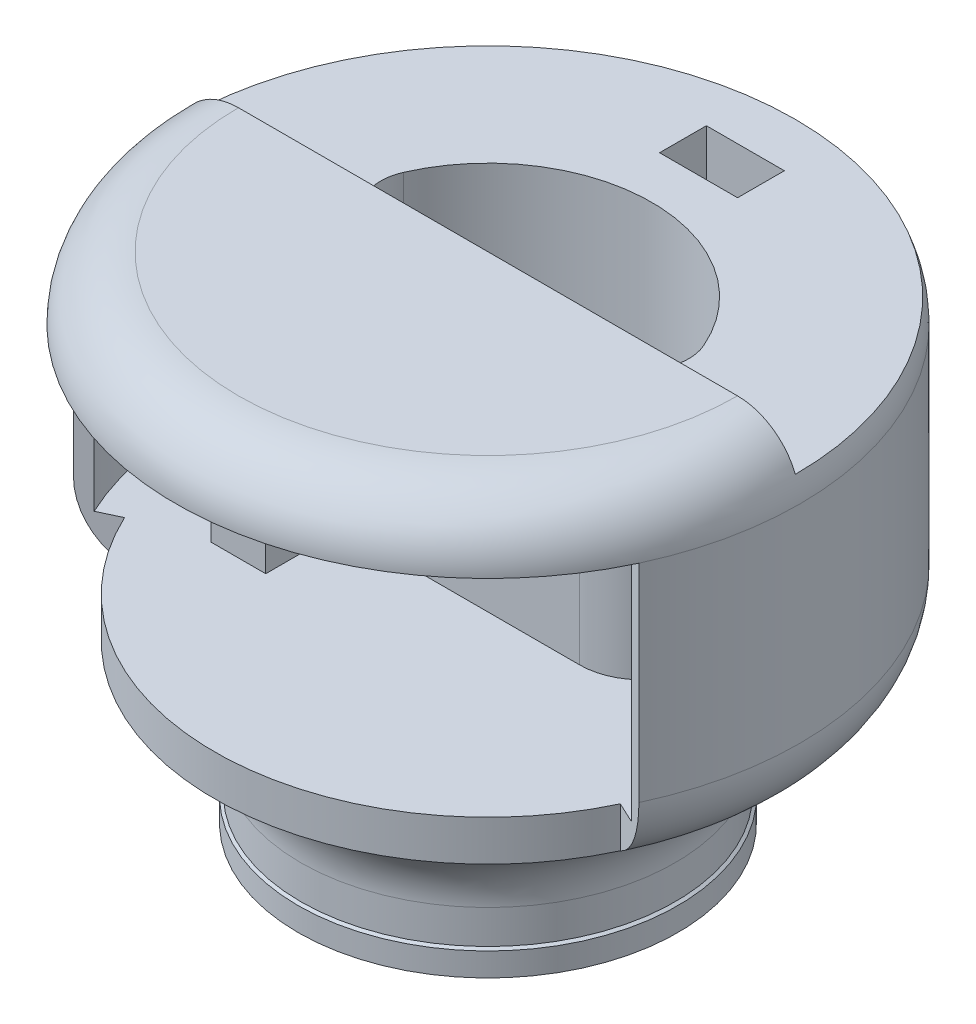
from build123d import *

# Parameters (mm, degrees)
CUT_EXTRUDE3_DEPTH           = 60
CUT_EXTRUDE5_DEPTH           = 2
CUT_EXTRUDE5_DEPTH_BACK      = 30
SKETCH9_R                    = 38
SKETCH9_R_2                  = 23
SKETCH19_W                   = 12
SKETCH19_H                   = 36.5
CUT_REVOLVE2_ANGLE           = 65
CUT_REVOLVE2_OTHER_WAY_ANGLE = 65
SKETCH21_W                   = 3.25
SKETCH21_H                   = 4
BOSS_EXTRUDE3_DEPTH          = 1.35
CIRPATTERN1_COUNT            = 5
CUT_EXTRUDE9_START           = -5
CUT_EXTRUDE9_DEPTH           = 5
SKETCH23_R                   = 10.5
CUT_EXTRUDE10_DEPTH          = 10
SKETCH24_W                   = 15
SKETCH24_H                   = 8
BOSS_EXTRUDE4_DEPTH          = 8
SKETCH26_W                   = 10
SKETCH26_H                   = 6
CUT_EXTRUDE11_DEPTH          = 10
SKETCH27_W                   = 4
SKETCH27_H                   = 5
CUT_EXTRUDE12_DEPTH          = 5
CUT_EXTRUDE14_DEPTH          = 2
CUT_EXTRUDE14_DEPTH_BACK     = 30
SKETCH29_R                   = 1
CUT_EXTRUDE15_DEPTH          = 15
FILLET1_R                    = 6
FILLET2_R                    = 8
SKETCH31_W                   = 7
SKETCH31_H                   = 5
BOSS_EXTRUDE7_DEPTH          = 13
SKETCH32_R                   = 1.25
CUT_EXTRUDE16_DEPTH          = 7.5


with BuildPart() as part:
    # Sketch1 → Revolve1 (revolve)
    with BuildSketch(Plane.XY):
        with BuildLine():
            Line((0, 63.427876097), (32, 63.427876097))
            ThreePointArc((32, 63.427876097), (37.656854249, 61.084730346), (40, 55.427876097))
            Line((40, 55.427876097), (40, 28.846818009))
            ThreePointArc((40, 28.846818009), (38.792081772, 24.082439968), (35.460140376, 20.469057744))
            Line((35.460140376, 20.469057744), (28.539859624, 15.958818353))
            ThreePointArc((28.539859624, 15.958818353), (25.207918228, 12.345436129), (24, 7.581058088))
            Line((24, 7.581058088), (24, 3.25))
            Line((24, 3.25), (24.35, 3))
            Line((24.35, 3), (24.35, 0))
            Line((24.35, 0), (22.5, 0))
            Line((22.5, 0), (22.5, 12.5))
            ThreePointArc((22.5, 12.5), (22.353553391, 12.853553391), (22, 13))
            Line((22, 13), (0, 13))
            Line((0, 13), (0, 63.427876097))
        make_face()
    revolve(axis=Axis((0, 0, 0), (0, 1, 0)))

    # Sketch11 → Cut-Extrude3 (cut)
    with BuildSketch(Plane(origin=(0, 13, 0), x_dir=(-1, 0, 0), z_dir=(0, -1, 0))):
        with BuildLine():
            Line((-21, 0), (21, 0))
            ThreePointArc((21, 0), (0, 21), (-21, 0))
        make_face()
    extrude(amount=-CUT_EXTRUDE3_DEPTH, mode=Mode.SUBTRACT)

    # Sketch9 → Cut-Extrude5 (cut, two sides: drawn at the far end of the back side and taken through both)
    with BuildSketch(Plane(origin=(0, 55.427876097, 0), x_dir=(1, 0, 0), z_dir=(0, 1, 0)).offset(-CUT_EXTRUDE5_DEPTH_BACK)):
        Circle(SKETCH9_R)
        Circle(SKETCH9_R_2, mode=Mode.SUBTRACT)
    extrude(amount=CUT_EXTRUDE5_DEPTH + CUT_EXTRUDE5_DEPTH_BACK, mode=Mode.SUBTRACT)

    # Sketch19 → Cut-Revolve2 (revolve, cut)
    with BuildSketch(Plane(origin=(0, 0, 0), x_dir=(0, 0, -1), z_dir=(1, 0, 0))):
        with Locations((-41.064715832, 37.177876097)):
            Rectangle(SKETCH19_W, SKETCH19_H)
    revolve(axis=Axis((0, 0, 0), (0, 1, 0)), revolution_arc=CUT_REVOLVE2_ANGLE, mode=Mode.SUBTRACT)

    # Sketch19 → Cut-Revolve2 other way (revolve, cut)
    with BuildSketch(Plane(origin=(0, 0, 0), x_dir=(0, 0, -1), z_dir=(1, 0, 0))):
        with Locations((-41.064715832, 37.177876097)):
            Rectangle(SKETCH19_W, SKETCH19_H)
    revolve(axis=Axis((0, 0, 0), (0, -1, 0)), revolution_arc=CUT_REVOLVE2_OTHER_WAY_ANGLE, mode=Mode.SUBTRACT)

    # Sketch21 → Boss-Extrude3 (add)
    with BuildSketch(Plane(origin=(0, 0, 22.5), x_dir=(-1, 0, 0), z_dir=(0, 0, -1))):
        with Locations((0, 2)):
            Rectangle(SKETCH21_W, SKETCH21_H)
    boss_extrude3 = extrude(amount=BOSS_EXTRUDE3_DEPTH)

    # CirPattern1: Boss-Extrude3 ×5 about axis
    cirpattern1_axis = Axis((0, 0, 0), (0, -1, 0))
    for i in range(1, CIRPATTERN1_COUNT):
        add(boss_extrude3.rotate(cirpattern1_axis, i * 360 / CIRPATTERN1_COUNT))

    # Sketch22 → Cut-Extrude9 (cut)
    with BuildSketch(Plane(origin=(0, 63.427876097, 0), x_dir=(1, 0, 0), z_dir=(0, 1, 0)).offset(CUT_EXTRUDE9_START)):
        with BuildLine():
            Line((-40, 0), (40, 0))
            ThreePointArc((40, 0), (0, 40), (-40, 0))
        make_face()
    extrude(amount=CUT_EXTRUDE9_DEPTH, mode=Mode.SUBTRACT)

    # Sketch23 → Cut-Extrude10 (cut)
    with BuildSketch(Plane(origin=(0, 0, -40), x_dir=(-1, 0, 0), z_dir=(0, 0, -1))):
        with Locations((0, 42.137876097)):
            Circle(SKETCH23_R)
    extrude(amount=-CUT_EXTRUDE10_DEPTH, mode=Mode.SUBTRACT)

    # Sketch24 → Boss-Extrude4 (add)
    with BuildSketch(Plane(origin=(0, 58.427876097, 0), x_dir=(1, 0, 0), z_dir=(0, 1, 0))):
        with Locations((0, 30)):
            Rectangle(SKETCH24_W, SKETCH24_H)
    extrude(amount=-BOSS_EXTRUDE4_DEPTH)

    # Sketch26 → Cut-Extrude11 (cut)
    with BuildSketch(Plane(origin=(0, 58.427876097, 0), x_dir=(1, 0, 0), z_dir=(0, 1, 0))):
        with Locations((0, 30)):
            Rectangle(SKETCH26_W, SKETCH26_H)
    extrude(amount=-CUT_EXTRUDE11_DEPTH, mode=Mode.SUBTRACT)

    # Sketch27 → Cut-Extrude12 (cut)
    with BuildSketch(Plane(origin=(7.5, 0, 0), x_dir=(0, 0, -1), z_dir=(1, 0, 0))):
        with Locations((30, 53.927876097)):
            Rectangle(SKETCH27_W, SKETCH27_H)
    extrude(amount=-CUT_EXTRUDE12_DEPTH, mode=Mode.SUBTRACT)

    # Sketch28 → Cut-Extrude14 (cut, two sides: drawn at the far end of the back side and taken through both)
    with BuildSketch(Plane(origin=(0, 55.427876097, 0), x_dir=(1, 0, 0), z_dir=(0, 1, 0)).offset(-CUT_EXTRUDE14_DEPTH_BACK)):
        with BuildLine():
            Line((-22.912878475, -2), (22.912878475, -2))
            ThreePointArc((22.912878475, -2), (0, -23), (-22.912878475, -2))
        make_face()
    extrude(amount=CUT_EXTRUDE14_DEPTH + CUT_EXTRUDE14_DEPTH_BACK, mode=Mode.SUBTRACT)

    # Sketch29 → Cut-Extrude15 (cut)
    with BuildSketch(Plane(origin=(0, 0, 0), x_dir=(-1, 0, 0), z_dir=(0, 0, -1))):
        with Locations((-30.416198487, 60.927876097)):
            Circle(SKETCH29_R)
        with Locations((30.416198487, 60.927876097)):
            Circle(SKETCH29_R)
        with Locations((0, 60.927876097)):
            Circle(SKETCH29_R)
    extrude(amount=-CUT_EXTRUDE15_DEPTH, mode=Mode.SUBTRACT)

    # Fillet1
    fillet1_edges = [part.edges().sort_by_distance(p)[0] for p in [
        (-21, 35.713938048, 0),
        (21, 35.713938048, 0),
    ]]
    fillet(fillet1_edges, radius=FILLET1_R)

    # Fillet2
    fillet2_edges = [part.edges().sort_by_distance(p)[0] for p in [
        (22.912878475, 41.427876097, 2),
        (-22.912878475, 41.427876097, 2),
    ]]
    fillet(fillet2_edges, radius=FILLET2_R)

    # Sketch31 → Boss-Extrude7 (add)
    with BuildSketch(Plane(origin=(0, 58.427876097, 0), x_dir=(1, 0, 0), z_dir=(0, 1, 0))):
        with Locations((0, -29.5)):
            Rectangle(SKETCH31_W, SKETCH31_H)
    extrude(amount=-BOSS_EXTRUDE7_DEPTH)

    # Sketch32 → Cut-Extrude16 (cut)
    with BuildSketch(Plane(origin=(3.5, 0, 0), x_dir=(0, 0, -1), z_dir=(1, 0, 0))):
        with Locations((-29.5, 48.427876097)):
            Circle(SKETCH32_R)
    extrude(amount=-CUT_EXTRUDE16_DEPTH, mode=Mode.SUBTRACT)


solid = part.part
